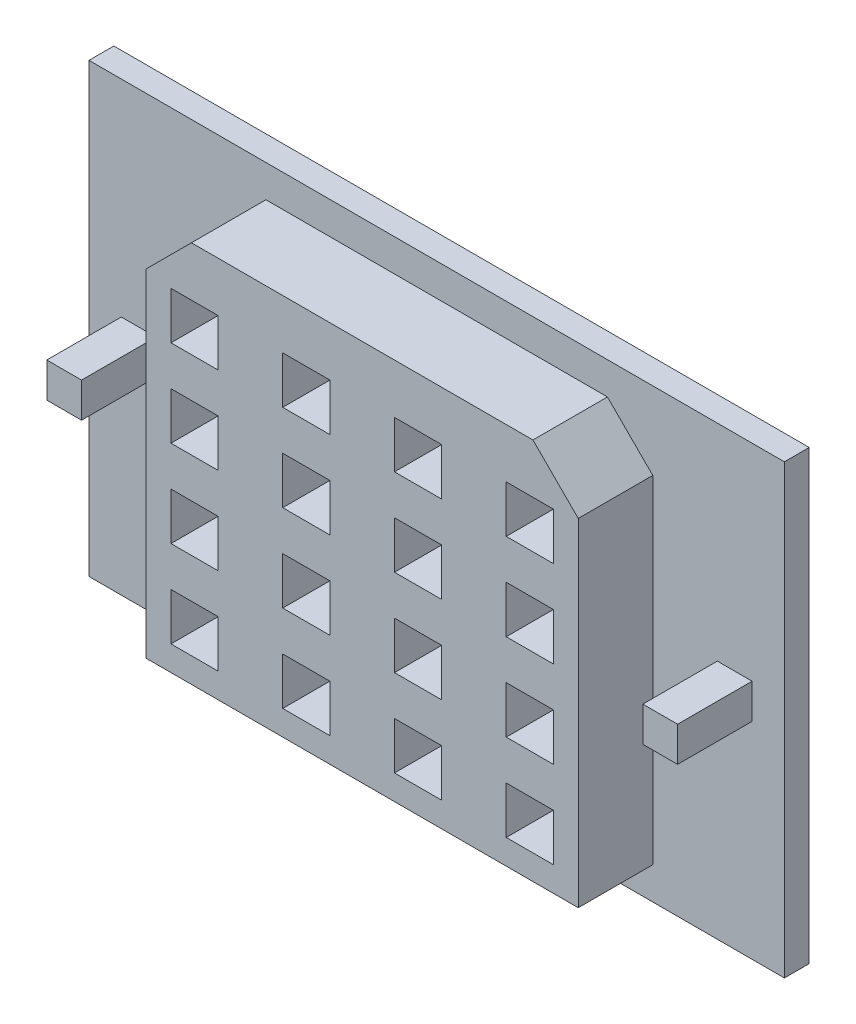
from build123d import *

# Parameters (mm, degrees)
SKETCH1_W               = 28
SKETCH1_H               = 18
BOSS_EXTRUDE1_DEPTH     = 1
SKETCH2_W               = 1.4
SKETCH2_H               = 1.4
BOSS_EXTRUDE3_DEPTH     = 3
CUT_EXTRUDE1_DEPTH      = 19.789301502
CUT_EXTRUDE1_DEPTH_BACK = 19.789301502
SKETCH3_W               = 1.9
SKETCH3_H               = 1.9


with BuildPart() as part:
    # Sketch1 → Boss-Extrude1 (new body)
    with BuildSketch(Plane.XY):
        with Locations((-1.236641221, -1.241221374)):
            Rectangle(SKETCH1_W, SKETCH1_H)
    extrude(amount=BOSS_EXTRUDE1_DEPTH)

    # Sketch2 → Boss-Extrude3 (add)
    with BuildSketch(Plane.XY.offset(1)):
        with Locations((10.763358779, -1.241221374)):
            Rectangle(SKETCH2_W, SKETCH2_H)
        with Locations((-13.236641221, -1.241221374)):
            Rectangle(SKETCH2_W, SKETCH2_H)
        Polygon((-8.112377153, 6.458778626), (5.63909471, 6.458778626), (7.463358779, 4.634514557), (7.463358779, -8.941221374), (-9.936641221, -8.941221374), (-9.936641221, 4.634514557), align=None)
    extrude(amount=BOSS_EXTRUDE3_DEPTH)

    # Sketch3 → Cut-Extrude1 (cut, two sides: drawn at the far end of the back side and taken through both)
    with BuildSketch(Plane.XY.offset(4).offset(-CUT_EXTRUDE1_DEPTH_BACK)):
        with Locations((1.013358779, 3.508778626)):
            Rectangle(SKETCH3_W, SKETCH3_H)
        with Locations((5.513358779, 3.508778626)):
            Rectangle(SKETCH3_W, SKETCH3_H)
        with Locations((-3.486641221, 3.508778626)):
            Rectangle(SKETCH3_W, SKETCH3_H)
        with Locations((-7.986641221, 3.508778626)):
            Rectangle(SKETCH3_W, SKETCH3_H)
        with Locations((1.013358779, 0.008778626)):
            Rectangle(SKETCH3_W, SKETCH3_H)
        with Locations((-3.486641221, 0.008778626)):
            Rectangle(SKETCH3_W, SKETCH3_H)
        with Locations((-7.986641221, 0.008778626)):
            Rectangle(SKETCH3_W, SKETCH3_H)
        with Locations((1.013358779, -3.491221374)):
            Rectangle(SKETCH3_W, SKETCH3_H)
        with Locations((-3.486641221, -3.491221374)):
            Rectangle(SKETCH3_W, SKETCH3_H)
        with Locations((-7.986641221, -3.491221374)):
            Rectangle(SKETCH3_W, SKETCH3_H)
        with Locations((1.013358779, -6.991221374)):
            Rectangle(SKETCH3_W, SKETCH3_H)
        with Locations((-3.486641221, -6.991221374)):
            Rectangle(SKETCH3_W, SKETCH3_H)
        with Locations((-7.986641221, -6.991221374)):
            Rectangle(SKETCH3_W, SKETCH3_H)
        with Locations((5.513358779, 0.008778626)):
            Rectangle(SKETCH3_W, SKETCH3_H)
        with Locations((5.513358779, -3.491221374)):
            Rectangle(SKETCH3_W, SKETCH3_H)
        with Locations((5.513358779, -6.991221374)):
            Rectangle(SKETCH3_W, SKETCH3_H)
    extrude(amount=CUT_EXTRUDE1_DEPTH + CUT_EXTRUDE1_DEPTH_BACK, mode=Mode.SUBTRACT)


solid = part.part
